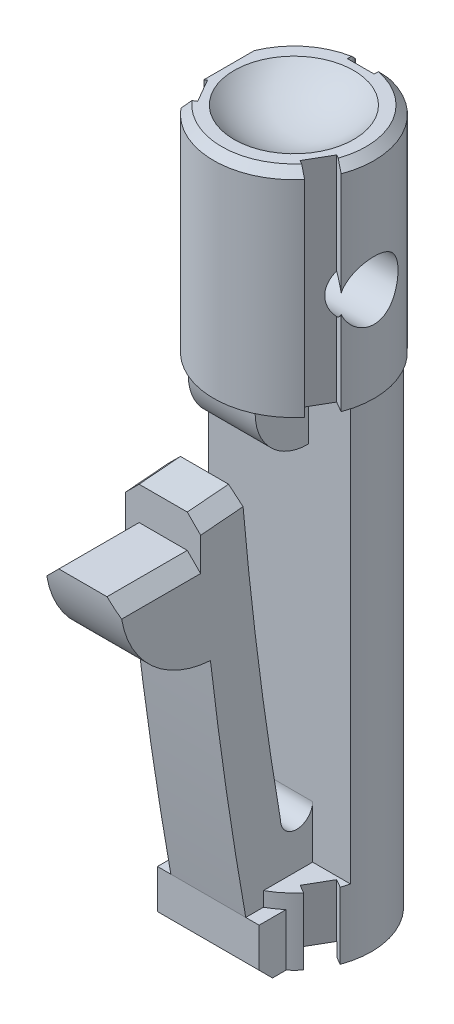
from build123d import *

# Parameters (mm, degrees)
EXTRUDE_1_DEPTH          = 1.9
EXTRUDE_2_DEPTH          = 1.4
SKETCH_3_R               = 3
EXTRUDE_3_DEPTH          = 8
EXTRUDE_4_DEPTH          = 1.25
SKETCH_4_R               = 2.9
EXTRUDE_5_DEPTH          = 2.5
SKETCH_6_R               = 2.6
CUT_EXTRUDE_1_DEPTH      = 0.5
EXTRUDE_6_DEPTH          = 20
CUT_EXTRUDE_2_DEPTH      = 27.054196915
CUT_EXTRUDE_2_DEPTH_BACK = 27.054196915
SKETCH_8_R               = 1.1
CHAMFER_1_SIZE           = 0.3
CHAMFER_2_SIZE           = 0.5
CHAMFER_3_SIZE           = 0.5
SKETCH_9_W               = 1
SKETCH_9_H               = 1
CUT_EXTRUDE_3_DEPTH      = 28.870046131
FILLET_1_R               = 0.2
CUT_EXTRUDE_4_DEPTH      = 27.054197019
CUT_EXTRUDE_4_DEPTH_BACK = 27.054197019
SKETCH_10_W              = 3.797458907
SKETCH_10_H              = 8.647225703
PATTERN_CIRCULAR_1_COUNT = 3
SKETCH_11_R              = 0.998175231
CUT_EXTRUDE_5_DEPTH      = 10


with BuildPart() as part:
    # 스케치2 → 보스-돌출1 (new, symmetric)
    with BuildSketch(Plane(origin=(0, 0, 0), x_dir=(0, 0, -1), z_dir=(1, 0, 0))):
        Polygon((-2.5, 14), (-2.5, 2.5), (-2.5, 0), (-5, 0), (-5, -1.959936322), (0, -1.959936322), (0, 0), (0, 16), (-2.5, 16), align=None)
    extrude(amount=EXTRUDE_1_DEPTH, both=True)

    # 스케치2<3> → 보스-돌출2 (add, symmetric)
    with BuildSketch(Plane(origin=(0, 0, 0), x_dir=(0, 0, -1), z_dir=(1, 0, 0))):
        with BuildLine():
            Line((-2.5, 0), (-2.5, 2.5))
            ThreePointArc((-2.5, 2.5), (-3.1, 1.9), (-3.7, 2.5))
            ThreePointArc((-3.7, 2.5), (-4.543155661, 8.157324795), (-5.142484869, 13.845649663))
            Line((-5.142484869, 13.845649663), (-6.686133226, 13.716475531))
            Line((-6.686133226, 13.716475531), (-6.686133226, 12.475529893))
            Line((-6.686133226, 12.475529893), (-9.686133226, 12.475529893))
            ThreePointArc((-9.686133226, 12.475529893), (-8.682007447, 10.072524954), (-6.319952588, 8.975529893))
            ThreePointArc((-6.319952588, 8.975529893), (-5.727516403, 4.477832414), (-5, 0))
            Line((-5, 0), (-2.5, 0))
        make_face()
    extrude(amount=EXTRUDE_2_DEPTH, both=True)

    # 스케치3 → 보스-돌출3 (add)
    with BuildSketch(Plane(origin=(0, 16, 0), x_dir=(1, 0, 0), z_dir=(0, 1, 0))):
        with Locations((0, -1.8)):
            Circle(SKETCH_3_R)
    extrude(amount=EXTRUDE_3_DEPTH)

    # 스케치2<4> → 보스-돌출4 (add, symmetric)
    with BuildSketch(Plane(origin=(0, 0, 0), x_dir=(0, 0, -1), z_dir=(1, 0, 0))):
        with BuildLine():
            ThreePointArc((-4.5, 16), (-3.914213562, 14.585786438), (-2.5, 14))
            Line((-2.5, 14), (-2.5, 16))
            Line((-2.5, 16), (-4.5, 16))
        make_face()
    extrude(amount=EXTRUDE_4_DEPTH, both=True)

    # 스케치4 → 보스-돌출5 (add)
    with BuildSketch(Plane.XZ.offset(1.959936322)):
        with Locations((0, 1.8)):
            Circle(SKETCH_4_R)
    extrude(amount=-EXTRUDE_5_DEPTH)

    # 스케치6 → 컷-돌출1 (cut)
    with BuildSketch(Plane.XZ.offset(1.959936322)):
        with Locations((0, 1.8)):
            Circle(SKETCH_6_R)
    extrude(amount=-CUT_EXTRUDE_1_DEPTH, mode=Mode.SUBTRACT)

    # 스케치7 → 보스-돌출6 (add)
    with BuildSketch(Plane(origin=(0, 0.540063678, 0), x_dir=(1, 0, 0), z_dir=(0, 1, 0))):
        with BuildLine():
            Line((-2.814249456, -2.5), (2.814249456, -2.5))
            ThreePointArc((2.814249456, -2.5), (0, 1.1), (-2.814249456, -2.5))
        make_face()
    extrude(amount=EXTRUDE_6_DEPTH)

    # 스케치8 → 컷-돌출2 (cut, two sides: drawn at the far end of the back side and taken through both)
    with BuildSketch(Plane(origin=(0, 0, 0), x_dir=(0, 0, -1), z_dir=(1, 0, 0)).offset(-CUT_EXTRUDE_2_DEPTH_BACK)):
        with Locations((-1.8, 19.5)):
            Circle(SKETCH_8_R)
    extrude(amount=CUT_EXTRUDE_2_DEPTH + CUT_EXTRUDE_2_DEPTH_BACK, mode=Mode.SUBTRACT)

    # 모따기1
    chamfer_1_edges = [part.edges().sort_by_distance(p)[0] for p in [
        (-3, 24, 1.8),
    ]]
    chamfer(chamfer_1_edges, length=CHAMFER_1_SIZE)

    # 모따기2
    chamfer_2_edges = [part.edges().sort_by_distance(p)[0] for p in [
        (0, -1.959936322, 5),
    ]]
    chamfer(chamfer_2_edges, length=CHAMFER_2_SIZE)

    # 모따기3
    chamfer_3_edges = [part.edges().sort_by_distance(p)[0] for p in [
        (1.4, 12.475529893, 8.186133226),
        (-1.4, 12.475529893, 8.186133226),
        (1.4, 13.781062597, 5.914309048),
        (-1.4, 13.781062597, 5.914309048),
    ]]
    chamfer(chamfer_3_edges, length=CHAMFER_3_SIZE)

    # 스케치9 → 컷-돌출3 (cut, through all)
    with BuildSketch(Plane(origin=(0, 24, 0), x_dir=(1, 0, 0), z_dir=(0, 1, 0))):
        with Locations((0, 1.2)):
            Rectangle(SKETCH_9_W, SKETCH_9_H)
    cut_extrude_3 = extrude(amount=-CUT_EXTRUDE_3_DEPTH, mode=Mode.SUBTRACT)

    # 필렛1
    fillet_1_edges = [part.edges().sort_by_distance(p)[0] for p in [
        (0.5, 19.85, -1.158039892),
        (-0.5, 19.85, -1.158039892),
    ]]
    fillet(fillet_1_edges, radius=FILLET_1_R)

    # 스케치10 → 컷-돌출4 (cut, two sides: drawn at the far end of the back side and taken through both)
    with BuildSketch(Plane(origin=(0, 0, 0), x_dir=(1, 0, 0), z_dir=(0, 1, 0)).offset(-CUT_EXTRUDE_4_DEPTH_BACK)):
        with Locations((-4.398729453, -2.042577162)):
            Rectangle(SKETCH_10_W, SKETCH_10_H)
    extrude(amount=CUT_EXTRUDE_4_DEPTH + CUT_EXTRUDE_4_DEPTH_BACK, mode=Mode.SUBTRACT)

    # 원형 패턴1: 컷-돌출3 ×3 about axis
    pattern_circular_1_axis = Axis((0, 24, 1.8), (0, -1, 0))
    for i in range(1, PATTERN_CIRCULAR_1_COUNT):
        add(cut_extrude_3.rotate(pattern_circular_1_axis, i * 360 / PATTERN_CIRCULAR_1_COUNT), mode=Mode.SUBTRACT)

    # 스케치11 → 컷-돌출5 (cut)
    with BuildSketch(Plane.XZ.offset(1.459936322)):
        with Locations((-2.131830758, 2.277605457)):
            Circle(SKETCH_11_R)
    extrude(amount=CUT_EXTRUDE_5_DEPTH, mode=Mode.SUBTRACT)

    # 스케치12 → 컷-회전1 (revolve, cut)
    with BuildSketch(Plane(origin=(0, 0, 0), x_dir=(0, 0, -1), z_dir=(1, 0, 0))):
        with BuildLine():
            Line((-1.8, 29), (-1.8, 23))
            ThreePointArc((-1.8, 23), (1.2, 26), (-1.8, 29))
        make_face()
    revolve(axis=Axis((0, 19.5, 1.8), (0, 1, 0)), mode=Mode.SUBTRACT)


solid = part.part
